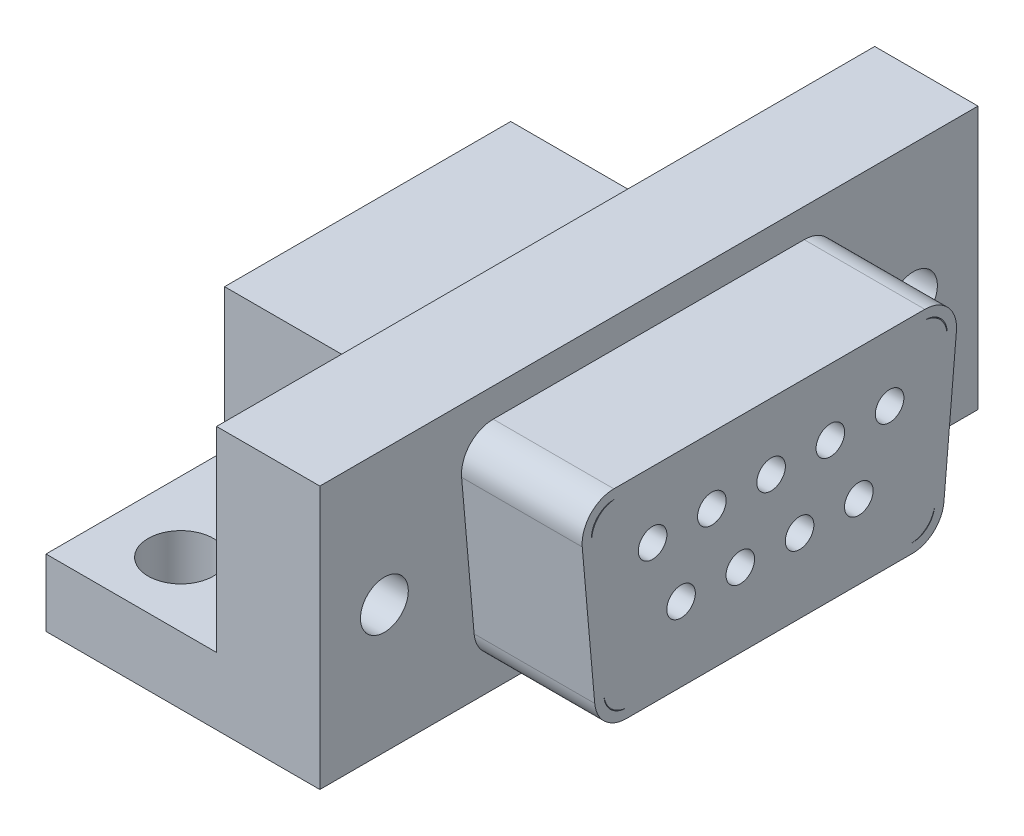
from build123d import *

# Parameters (mm, degrees)
BASE_EXTRUDE_DEPTH         = 31.1
SKETCH2_W                  = 13.52
SKETCH2_H                  = 6.37
BOSS_EXTRUDE1_DEPTH        = 8.41
SKETCH3_R                  = 1.545
BASE_MOUNTING_HOLE_1_DEPTH = 35.931591719
SKETCH5_R                  = 1.1305
FACE_MOUNTING_HOLES_DEPTH  = 37.029023023
SHELL_AROUND_PINS_DEPTH    = 5.7
SHELL1_START               = 0.44
SHELL1_DEPTH               = 18.2
SHELL1_START_2             = 8.5
SHELL1_2_OUTLINE_W         = 11.54
SHELL1_2_OUTLINE_H         = 30.22
SHELL1_2_OUTLINE_R         = 1.5705
SHELL1_2_DEPTH             = 4
SHELL1_START_3             = 12.5
SHELL1_3_DEPTH             = 6.14
SHELL1_START_4             = 5.3050001
SHELL1_4_DEPTH             = 3.1949999
SHELL1_5_DEPTH             = 0.8949999
SHELL1_START_5             = 0.09
SHELL1_6_OUTLINE_W         = 5.49
SHELL1_6_OUTLINE_H         = 12.64
SHELL1_6_DEPTH             = 0.35
SHELL1_7_DEPTH             = 2.29
BOSS_EXTRUDE2_DEPTH        = 3.9
BOSS_EXTRUDE3_DEPTH        = 6.24
SKETCH9_R                  = 0.675
CUT_EXTRUDE1_DEPTH         = 6.4


with BuildPart() as part:
    # Sketch1 → Base-Extrude (new body)
    with BuildSketch(Plane.XY):
        Polygon((0, 0), (12.94, 0), (12.94, 12.42), (8.06, 12.42), (8.06, 3.17), (0, 3.17), align=None)
    extrude(amount=BASE_EXTRUDE_DEPTH)

    # Sketch2 → Boss-Extrude1 (add)
    with BuildSketch(Plane.ZY.offset(-8.06)):
        with Locations((15.55, 6.355)):
            Rectangle(SKETCH2_W, SKETCH2_H)
    extrude(amount=BOSS_EXTRUDE1_DEPTH)

    # Sketch3 → Base Mounting Hole 1 (cut, through all)
    with BuildSketch(Plane(origin=(0, 3.17, 0), x_dir=(-1, 0, 0), z_dir=(0, 1, 0))):
        with Locations((-3.32, 3.05)):
            Circle(SKETCH3_R)
        with Locations((-3.32, 28.05)):
            Circle(SKETCH3_R)
    extrude(amount=-BASE_MOUNTING_HOLE_1_DEPTH, mode=Mode.SUBTRACT)

    # Sketch5 → Face Mounting Holes (cut, through all)
    with BuildSketch(Plane(origin=(12.94, 0, 0), x_dir=(0, 0, -1), z_dir=(1, 0, 0))):
        with Locations((-3.05, 6.04)):
            Circle(SKETCH5_R)
        with Locations((-28.05, 6.04)):
            Circle(SKETCH5_R)
    extrude(amount=-FACE_MOUNTING_HOLES_DEPTH, mode=Mode.SUBTRACT)

    # Sketch6 → Shell around Pins (add)
    with BuildSketch(Plane(origin=(12.94, 0, 0), x_dir=(0, 0, -1), z_dir=(1, 0, 0))):
        with BuildLine():
            Line((-22.906967712, 11.06), (-8.213032288, 11.06))
            ThreePointArc((-8.213032288, 11.06), (-7.106786662, 10.573025476), (-6.718825618, 9.428294154))
            Line((-6.718825618, 9.428294154), (-7.309392629, 2.728294154))
            ThreePointArc((-7.309392629, 2.728294154), (-7.790573821, 1.753754374), (-8.803599298, 1.36))
            Line((-8.803599298, 1.36), (-22.316400702, 1.36))
            ThreePointArc((-22.316400702, 1.36), (-23.329426179, 1.753754374), (-23.810607371, 2.728294154))
            Line((-23.810607371, 2.728294154), (-24.401174382, 9.428294154))
            ThreePointArc((-24.401174382, 9.428294154), (-24.013213338, 10.573025476), (-22.906967712, 11.06))
        make_face()
    extrude(amount=SHELL_AROUND_PINS_DEPTH)

    # Shell1: read off the stored shape, not the designer's step
    # Shell1 outline → Shell1 (cut)
    with BuildSketch(Plane.YZ.offset(SHELL1_START)):
        with BuildLine():
            Line((2.73, 21.87), (2.73, 23.368398801))
            ThreePointArc((2.73, 23.368398801), (2.06583377, 23.018469075), (1.8, 22.316400702))
            Line((1.8, 22.316400702), (1.8, 8.803599298))
            ThreePointArc((1.8, 8.803599298), (2.06583377, 8.101530925), (2.73, 7.751601199))
            Line((2.73, 7.751601199), (2.73, 9.23))
            Line((2.73, 9.23), (9.1, 9.23))
            Line((9.1, 9.23), (9.1, 21.87))
            Line((9.1, 21.87), (2.73, 21.87))
        make_face()
    extrude(amount=SHELL1_DEPTH, mode=Mode.SUBTRACT)

    # Shell1 2 outline → Shell1 2 (cut)
    with BuildSketch(Plane.YZ.offset(SHELL1_START_2)):
        with Locations((6.21, 15.55)):
            Rectangle(SHELL1_2_OUTLINE_W, SHELL1_2_OUTLINE_H)
        with Locations((6.04, 3.05)):
            Circle(SHELL1_2_OUTLINE_R, mode=Mode.SUBTRACT)
        with Locations((6.04, 28.05)):
            Circle(SHELL1_2_OUTLINE_R, mode=Mode.SUBTRACT)
        with BuildLine():
            ThreePointArc((1.8, 22.316400702), (2.06583377, 23.018469075), (2.73, 23.368398801))
            Line((2.73, 23.368398801), (2.73, 21.87))
            Line((2.73, 21.87), (9.1, 21.87))
            Line((9.1, 21.87), (9.1, 9.23))
            Line((9.1, 9.23), (2.73, 9.23))
            Line((2.73, 9.23), (2.73, 7.751601199))
            ThreePointArc((2.73, 7.751601199), (2.06583377, 8.101530925), (1.8, 8.803599298))
            Line((1.8, 8.803599298), (1.8, 22.316400702))
        make_face(mode=Mode.SUBTRACT)
    extrude(amount=SHELL1_2_DEPTH, mode=Mode.SUBTRACT)

    # Shell1 3 outline → Shell1 3 (cut)
    with BuildSketch(Plane.YZ.offset(SHELL1_START_3)):
        with BuildLine():
            ThreePointArc((2.766927869, 23.372306748), (2.74844682, 23.370514495), (2.73, 23.368398801))
            Line((2.73, 23.368398801), (2.73, 21.87))
            Line((2.73, 21.87), (9.1, 21.87))
            Line((9.1, 21.87), (9.1, 9.23))
            Line((9.1, 9.23), (2.73, 9.23))
            Line((2.73, 9.23), (2.73, 7.751601199))
            ThreePointArc((2.73, 7.751601199), (2.74844682, 7.749485505), (2.766927869, 7.747693252))
            Line((2.766927869, 7.747693252), (9.466927869, 7.157126241))
            ThreePointArc((9.466927869, 7.157126241), (10.275871337, 7.431285379), (10.62, 8.213032288))
            Line((10.62, 8.213032288), (10.62, 22.906967712))
            ThreePointArc((10.62, 22.906967712), (10.275871337, 23.688714621), (9.466927869, 23.962873759))
            Line((9.466927869, 23.962873759), (2.766927869, 23.372306748))
        make_face()
    extrude(amount=SHELL1_3_DEPTH, mode=Mode.SUBTRACT)

    # Shell1 4 outline → Shell1 4 (cut)
    with BuildSketch(Plane.YZ.offset(SHELL1_START_4)):
        with BuildLine():
            Line((2.73, 23.368398801), (2.73, 30.66))
            Line((2.73, 30.66), (0.44, 30.66))
            Line((0.44, 30.66), (0.44, 0.44))
            Line((0.44, 0.44), (2.73, 0.44))
            Line((2.73, 0.44), (2.73, 7.751601199))
            ThreePointArc((2.73, 7.751601199), (2.06583377, 8.101530925), (1.8, 8.803599298))
            Line((1.8, 8.803599298), (1.8, 22.316400702))
            ThreePointArc((1.8, 22.316400702), (2.06583377, 23.018469075), (2.73, 23.368398801))
        make_face()
    extrude(amount=SHELL1_4_DEPTH, mode=Mode.SUBTRACT)

    # Shell1 5 outline → Shell1 5 (cut)
    with BuildSketch(Plane.YZ.offset(SHELL1_START)):
        with BuildLine():
            Line((2.73, 23.368398801), (2.73, 30.66))
            Line((2.73, 30.66), (0.44, 30.66))
            Line((0.44, 30.66), (0.44, 0.44))
            Line((0.44, 0.44), (2.73, 0.44))
            Line((2.73, 0.44), (2.73, 7.751601199))
            ThreePointArc((2.73, 7.751601199), (2.06583377, 8.101530925), (1.8, 8.803599298))
            Line((1.8, 8.803599298), (1.8, 22.316400702))
            ThreePointArc((1.8, 22.316400702), (2.06583377, 23.018469075), (2.73, 23.368398801))
        make_face()
    extrude(amount=SHELL1_5_DEPTH, mode=Mode.SUBTRACT)

    # Shell1 6 outline → Shell1 6 (cut)
    with BuildSketch(Plane.YZ.offset(SHELL1_START_5)):
        with Locations((6.355, 15.55)):
            Rectangle(SHELL1_6_OUTLINE_W, SHELL1_6_OUTLINE_H)
    extrude(amount=SHELL1_6_DEPTH, mode=Mode.SUBTRACT)

    # Shell1 7 outline → Shell1 7 (cut)
    with BuildSketch(Plane(origin=(0, 0, 0), x_dir=(1, 0, 0), z_dir=(0, 1, 0)).offset(SHELL1_START)):
        with BuildLine():
            Line((1.335, -28.05), (1.3349999, -30.66))
            Line((1.3349999, -30.66), (5.3050001, -30.66))
            Line((5.3050001, -30.66), (5.305, -28.05))
            ThreePointArc((5.305, -28.05), (3.32, -30.035), (1.335, -28.05))
        make_face()
        with BuildLine():
            Line((1.335, -3.049999981), (1.335, -28.05))
            ThreePointArc((1.335, -28.05), (3.32, -26.065), (5.305, -28.05))
            Line((5.305, -28.05), (5.305, -3.05))
            ThreePointArc((5.305, -3.05), (3.31999999, -5.035), (1.335, -3.049999981))
        make_face()
        with BuildLine():
            Line((1.3349999, -0.44), (1.335, -3.049999981))
            ThreePointArc((1.335, -3.049999981), (3.32000001, -1.065), (5.305, -3.05))
            Line((5.305, -3.05), (5.3050001, -0.44))
            Line((5.3050001, -0.44), (1.3349999, -0.44))
        make_face()
    extrude(amount=SHELL1_7_DEPTH, mode=Mode.SUBTRACT)

    # Sketch7 → Boss-Extrude2 (add)
    with BuildSketch(Plane(origin=(8.5, 0, 0), x_dir=(0, 0, -1), z_dir=(1, 0, 0))):
        with BuildLine():
            Line((-22.235829146, 1.8), (-8.884170854, 1.8))
            ThreePointArc((-8.884170854, 1.8), (-8.10887823, 2.10134964), (-7.740618755, 2.84718824))
            Line((-7.740618755, 2.84718824), (-7.165562656, 9.371216493))
            ThreePointArc((-7.165562656, 9.371216493), (-7.462478522, 10.247306751), (-8.309114756, 10.62))
            Line((-8.309114756, 10.62), (-22.810885244, 10.62))
            ThreePointArc((-22.810885244, 10.62), (-23.657521478, 10.247306751), (-23.954437344, 9.371216493))
            Line((-23.954437344, 9.371216493), (-23.379381245, 2.84718824))
            ThreePointArc((-23.379381245, 2.84718824), (-23.01112177, 2.10134964), (-22.235829146, 1.8))
        make_face()
    extrude(amount=BOSS_EXTRUDE2_DEPTH)

    # Sketch8 → Boss-Extrude3 (add)
    with BuildSketch(Plane(origin=(12.4, 0, 0), x_dir=(0, 0, -1), z_dir=(1, 0, 0))):
        with BuildLine():
            Line((-22.235829146, 1.8), (-8.884170854, 1.8))
            ThreePointArc((-8.884170854, 1.8), (-8.10887823, 2.10134964), (-7.740618755, 2.84718824))
            Line((-7.740618755, 2.84718824), (-7.165562656, 9.371216493))
            ThreePointArc((-7.165562656, 9.371216493), (-7.462478522, 10.247306751), (-8.309114756, 10.62))
            Line((-8.309114756, 10.62), (-22.810885244, 10.62))
            ThreePointArc((-22.810885244, 10.62), (-23.657521478, 10.247306751), (-23.954437344, 9.371216493))
            Line((-23.954437344, 9.371216493), (-23.379381245, 2.84718824))
            ThreePointArc((-23.379381245, 2.84718824), (-23.01112177, 2.10134964), (-22.235829146, 1.8))
        make_face()
    extrude(amount=BOSS_EXTRUDE3_DEPTH)

    # Sketch9 → Cut-Extrude1 (cut)
    with BuildSketch(Plane(origin=(18.64, 0, 0), x_dir=(0, 0, -1), z_dir=(1, 0, 0))):
        with Locations((-21.076586145, 7.934935328)):
            Circle(SKETCH9_R)
        with Locations((-18.276586145, 7.934935328)):
            Circle(SKETCH9_R)
        with Locations((-15.476586145, 7.934935328)):
            Circle(SKETCH9_R)
        with Locations((-12.676586145, 7.934935328)):
            Circle(SKETCH9_R)
        with Locations((-9.876586145, 7.934935328)):
            Circle(SKETCH9_R)
        with Locations((-19.731423712, 4.86314649)):
            Circle(SKETCH9_R)
        with Locations((-16.931423712, 4.86314649)):
            Circle(SKETCH9_R)
        with Locations((-14.131423712, 4.86314649)):
            Circle(SKETCH9_R)
        with Locations((-11.331423712, 4.86314649)):
            Circle(SKETCH9_R)
    extrude(amount=-CUT_EXTRUDE1_DEPTH, mode=Mode.SUBTRACT)


solid = part.part
